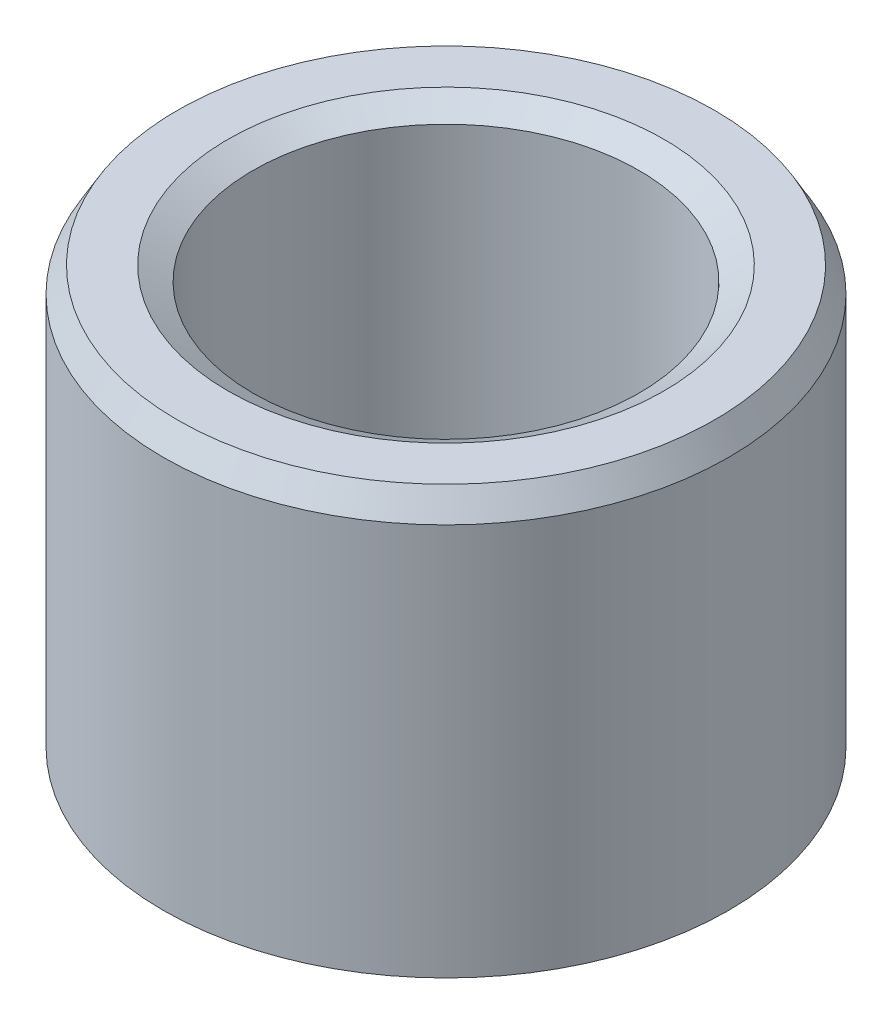
from build123d import *
from OCP.BRepFilletAPI import BRepFilletAPI_MakeChamfer

# Parameters (mm, degrees)
SKETCH1_R           = 27.5
BOSS_EXTRUDE1_DEPTH = 41.984927093
SKETCH2_R           = 18.765712102
CUT_EXTRUDE1_DEPTH  = 58.229661042
CHAMFER1_SIZE       = 2.43178662
CHAMFER1_SIZE2      = 1.40399266


with BuildPart() as part:
    # Sketch1 → Boss-Extrude1 (new body)
    with BuildSketch(Plane(origin=(0, 0, 0), x_dir=(1, 0, 0), z_dir=(0, 1, 0))):
        Circle(SKETCH1_R)
    extrude(amount=BOSS_EXTRUDE1_DEPTH)

    # Sketch2 → Cut-Extrude1 (cut, through all)
    with BuildSketch(Plane(origin=(0, 0, 0), x_dir=(1, 0, 0), z_dir=(0, 1, 0))):
        Circle(SKETCH2_R)
    extrude(amount=CUT_EXTRUDE1_DEPTH, mode=Mode.SUBTRACT)

    # Chamfer1: one chamfer whose edges measure the first distance from different faces: ONE call of the kernel's chamfer builder (chamfer() names one face for all edges)
    chamfer1_edges_1 = [part.edges().sort_by_distance(p)[0] for p in [
        (-18.765712102, 41.984927093, 0),
    ]]
    chamfer1_side_1 = [part.faces().sort_by_distance(p)[0] for p in [
        (-26.722182541, 41.984927093, 0),
    ]]
    chamfer1_edges_2 = [part.edges().sort_by_distance(p)[0] for p in [
        (-18.765712102, 0, 0),
    ]]
    chamfer1_side_2 = [part.faces().sort_by_distance(p)[0] for p in [
        (-18.765712102, 20.992463547, 0),
    ]]
    chamfer1_edges_3 = [part.edges().sort_by_distance(p)[0] for p in [
        (-27.5, 0, 0),
    ]]
    chamfer1_side_3 = [part.faces().sort_by_distance(p)[0] for p in [
        (-26.722182541, 0, 0),
    ]]
    chamfer1_edges_4 = [part.edges().sort_by_distance(p)[0] for p in [
        (-27.5, 41.984927093, 0),
    ]]
    chamfer1_side_4 = [part.faces().sort_by_distance(p)[0] for p in [
        (-27.5, 20.992463547, 0),
    ]]
    chamfer1 = BRepFilletAPI_MakeChamfer(part.part.solid().wrapped)
    for e in chamfer1_edges_1:
        chamfer1.Add(CHAMFER1_SIZE, CHAMFER1_SIZE2, e.wrapped, chamfer1_side_1[0].wrapped)  # the first distance lies on this face
    for e in chamfer1_edges_2:
        chamfer1.Add(CHAMFER1_SIZE, CHAMFER1_SIZE2, e.wrapped, chamfer1_side_2[0].wrapped)  # the first distance lies on this face
    for e in chamfer1_edges_3:
        chamfer1.Add(CHAMFER1_SIZE, CHAMFER1_SIZE2, e.wrapped, chamfer1_side_3[0].wrapped)  # the first distance lies on this face
    for e in chamfer1_edges_4:
        chamfer1.Add(CHAMFER1_SIZE, CHAMFER1_SIZE2, e.wrapped, chamfer1_side_4[0].wrapped)  # the first distance lies on this face
    add(Compound.cast(chamfer1.Shape()), mode=Mode.REPLACE)


solid = part.part
